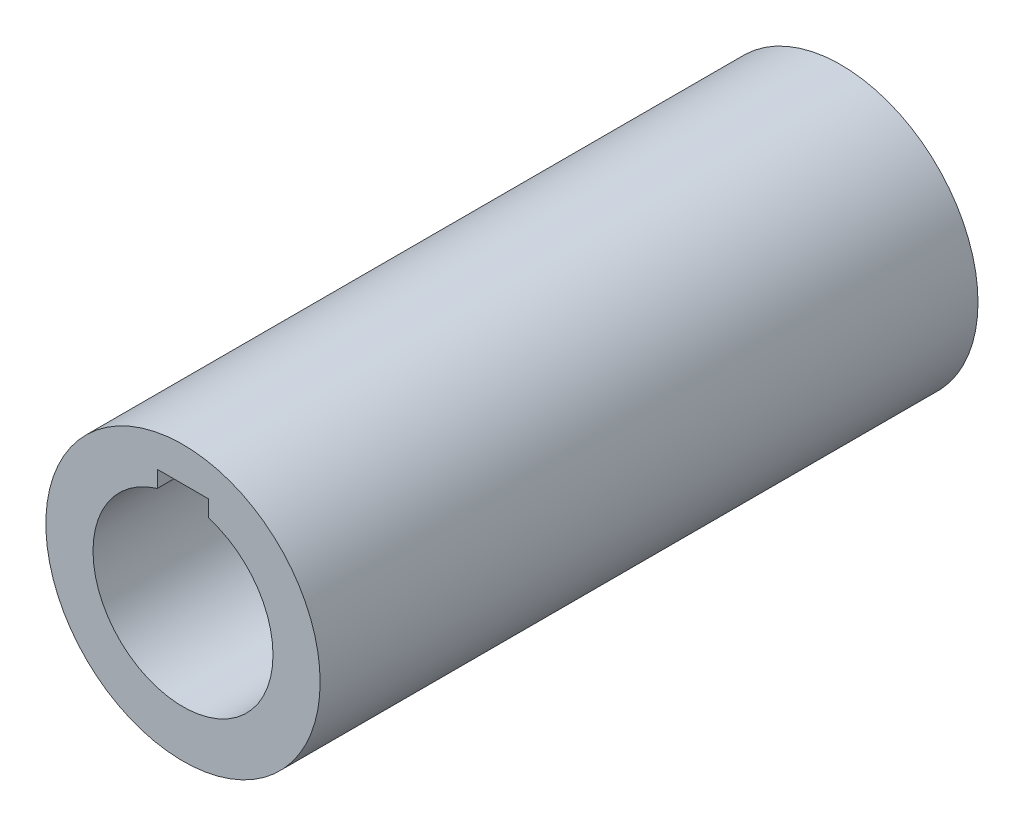
from build123d import *

# Parameters (mm, degrees)
SKETCH1_R           = 32
SKETCH1_R_2         = 21
BOSS_EXTRUDE1_DEPTH = 153.5
SKETCH2_W           = 12
SKETCH2_H           = 3.875388203
CUT_EXTRUDE1_DEPTH  = 161.032028044


with BuildPart() as part:
    # Sketch1 → Boss-Extrude1 (new body)
    with BuildSketch(Plane.XY):
        Circle(SKETCH1_R)
        Circle(SKETCH1_R_2, mode=Mode.SUBTRACT)
    extrude(amount=BOSS_EXTRUDE1_DEPTH)

    # Sketch2 → Cut-Extrude1 (cut, through all)
    with BuildSketch(Plane.XY.offset(153.5)):
        with Locations((0, 22.062305899)):
            Rectangle(SKETCH2_W, SKETCH2_H)
    extrude(amount=-CUT_EXTRUDE1_DEPTH, mode=Mode.SUBTRACT)


solid = part.part
